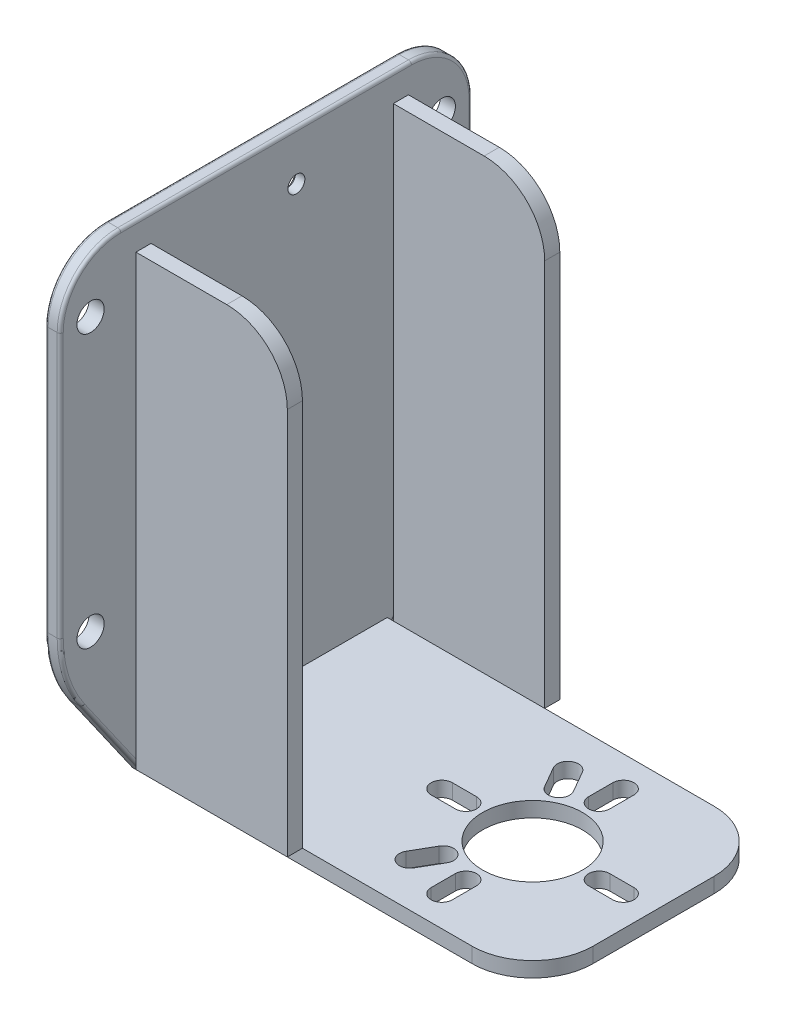
from build123d import *

# Parameters (mm, degrees)
SKETCH_1_W          = 64
SKETCH_1_H          = 40
SKETCH_1_R          = 8.25
EXTRUDE_1_DEPTH     = 2.5
EXTRUDE_2_DEPTH     = 2.5
SKETCH_6_W          = 2.5
SKETCH_6_H          = 68.008301529
EXTRUDE_3_DEPTH     = 60
SKETCH_7_R          = 2.25
CUT_EXTRUDE_1_DEPTH = 123.347999271
FILLET_1_R          = 10
FILLET_2_R          = 20
FILLET_4_R          = 10
FILLET_12_R         = 0.5
FILLET_13_R         = 0.5
SKETCH_8_W          = 25
SKETCH_8_H          = 2.5
EXTRUDE_5_DEPTH     = 74
EXTRUDE_5_2_DEPTH   = 74
FILLET_14_R         = 10
FILLET_15_R         = 10


with BuildPart() as part:
    # 草图1 → 凸台-拉伸1 (new body)
    with BuildSketch(Plane(origin=(0, 0, 0), x_dir=(1, 0, 0), z_dir=(0, 1, 0))):
        with Locations((-45.647943628, 32.876585816)):
            Rectangle(SKETCH_1_W, SKETCH_1_H)
        with Locations((-33.647943628, 32.876585816)):
            Circle(SKETCH_1_R, mode=Mode.SUBTRACT)
        with BuildLine():
            Line((-18.647943628, 31.126585816), (-22.647943628, 31.126585816))
            ThreePointArc((-22.647943628, 31.126585816), (-24.397943628, 32.876585816), (-22.647943628, 34.626585816))
            Line((-22.647943628, 34.626585816), (-18.647943628, 34.626585816))
            ThreePointArc((-18.647943628, 34.626585816), (-16.897943628, 32.876585816), (-18.647943628, 31.126585816))
        make_face(mode=Mode.SUBTRACT)
        with BuildLine():
            Line((-35.397943628, 17.876585816), (-35.397943628, 21.876585816))
            ThreePointArc((-35.397943628, 21.876585816), (-33.647943628, 23.626585816), (-31.897943628, 21.876585816))
            Line((-31.897943628, 21.876585816), (-31.897943628, 17.876585816))
            ThreePointArc((-31.897943628, 17.876585816), (-33.647943628, 16.126585816), (-35.397943628, 17.876585816))
        make_face(mode=Mode.SUBTRACT)
        with BuildLine():
            Line((-48.647943628, 34.626585816), (-44.647943628, 34.626585816))
            ThreePointArc((-44.647943628, 34.626585816), (-42.897943628, 32.876585816), (-44.647943628, 31.126585816))
            Line((-44.647943628, 31.126585816), (-48.647943628, 31.126585816))
            ThreePointArc((-48.647943628, 31.126585816), (-50.397943628, 32.876585816), (-48.647943628, 34.626585816))
        make_face(mode=Mode.SUBTRACT)
        with BuildLine():
            Line((-31.897943628, 47.876585816), (-31.897943628, 43.876585816))
            ThreePointArc((-31.897943628, 43.876585816), (-33.647943628, 42.126585816), (-35.397943628, 43.876585816))
            Line((-35.397943628, 43.876585816), (-35.397943628, 47.876585816))
            ThreePointArc((-35.397943628, 47.876585816), (-33.647943628, 49.626585816), (-31.897943628, 47.876585816))
        make_face(mode=Mode.SUBTRACT)
        with BuildLine():
            Line((-42.663488085, 21.01120476), (-40.663488085, 24.475306375))
            ThreePointArc((-40.663488085, 24.475306375), (-38.272943628, 25.115850831), (-37.632399171, 22.725306375))
            Line((-37.632399171, 22.725306375), (-39.632399171, 19.26120476))
            ThreePointArc((-39.632399171, 19.26120476), (-42.022943628, 18.620660303), (-42.663488085, 21.01120476))
        make_face(mode=Mode.SUBTRACT)
        with BuildLine():
            Line((-39.41589282, 46.866966873), (-37.41589282, 43.402865258))
            ThreePointArc((-37.41589282, 43.402865258), (-38.056437277, 41.012320801), (-40.446981734, 41.652865258))
            Line((-40.446981734, 41.652865258), (-42.446981734, 45.116966873))
            ThreePointArc((-42.446981734, 45.116966873), (-41.806437277, 47.50751133), (-39.41589282, 46.866966873))
        make_face(mode=Mode.SUBTRACT)
    extrude(amount=EXTRUDE_1_DEPTH)

    # 草图2 → 凸台-拉伸2 (add)
    with BuildSketch(Plane.ZY.offset(77.647943628)):
        Polygon((-66.880736581, 20), (-52.876585816, 0), (-12.876585816, 0), (1.127564948, 20), align=None)
    extrude(amount=EXTRUDE_2_DEPTH)

    # 草图6 → 凸台-拉伸3 (add)
    with BuildSketch(Plane(origin=(0, 20, 0), x_dir=(1, 0, 0), z_dir=(0, 1, 0))):
        with Locations((-78.897943628, 32.876585817)):
            Rectangle(SKETCH_6_W, SKETCH_6_H)
    extrude(amount=EXTRUDE_3_DEPTH)

    # 草图7 → 切除-拉伸1 (cut, through all)
    with BuildSketch(Plane(origin=(-77.647943628, 0, 0), x_dir=(0, 0, -1), z_dir=(1, 0, 0))):
        with Locations((61.880736581, 25)):
            Circle(SKETCH_7_R)
        with Locations((3.880736581, 25)):
            Circle(SKETCH_7_R)
        with Locations((61.880736581, 70)):
            Circle(SKETCH_7_R)
        with Locations((3.880736581, 70)):
            Circle(SKETCH_7_R)
    extrude(amount=-CUT_EXTRUDE_1_DEPTH, mode=Mode.SUBTRACT)

    # 圆角1
    fillet_1_edges = [part.edges().sort_by_distance(p)[0] for p in [
        (-13.647943628, 1.25, -12.876585816),
        (-13.647943628, 1.25, -52.876585816),
    ]]
    fillet(fillet_1_edges, radius=FILLET_1_R)

    # 圆角2
    fillet_2_edges = [part.edges().sort_by_distance(p)[0] for p in [
        (-78.897943628, 20, -66.880736581),
        (-78.897943628, 20, 1.127564948),
    ]]
    fillet(fillet_2_edges, radius=FILLET_2_R)

    # 圆角4
    fillet_4_edges = [part.edges().sort_by_distance(p)[0] for p in [
        (-78.897943628, 80, 1.127564948),
        (-78.897943628, 80, -66.880736581),
    ]]
    fillet(fillet_4_edges, radius=FILLET_4_R)

    # 圆角12
    fillet_12_edges = [part.edges().sort_by_distance(p)[0] for p in [
        (-77.647943628, 7.417223525, -58.070181641),
        (-77.647943628, 20.291859787, -65.955075596),
        (-77.647943628, 48.152987889, -66.880736581),
        (-77.647943628, 77.071067812, -63.951804393),
        (-77.647943628, 80, -32.876585816),
        (-77.647943628, 77.071067812, -1.80136724),
        (-77.647943628, 7.417223525, -7.682989991),
        (-77.647943628, 20.291859787, 0.201903963),
        (-77.647943628, 48.152987889, 1.127564948),
    ]]
    fillet(fillet_12_edges, radius=FILLET_12_R)

    # 圆角13
    fillet_13_edges = [part.edges().sort_by_distance(p)[0] for p in [
        (-80.147943628, 7.417223525, -58.070181641),
        (-80.147943628, 20.291859787, -65.955075596),
        (-80.147943628, 48.152987889, -66.880736581),
        (-80.147943628, 77.071067812, -63.951804393),
        (-80.147943628, 80, -32.876585816),
        (-80.147943628, 77.071067812, -1.80136724),
        (-80.147943628, 7.417223525, -7.682989991),
        (-80.147943628, 20.291859787, 0.201903963),
        (-80.147943628, 48.152987889, 1.127564948),
    ]]
    fillet(fillet_13_edges, radius=FILLET_13_R)

    # 草图13 → #3 平头机械螺钉的锥形沉头孔 (100)1 (revolve, cut)
    with BuildSketch(Plane(origin=(-80.147943628, 72, -37.876585816), x_dir=(0, 0, 1), z_dir=(0, 1, 0))):
        Polygon((0, 0), (0, 66.5), (1.397, 66.5), (1.397, 0.948434313), (2.5273, 0), align=None)
    revolve(axis=Axis((-86.497943628, 72, -37.876585816), (1, 0, 0)), mode=Mode.SUBTRACT)


with BuildPart() as body_2:
    # 草图8 → 凸台-拉伸5 (new body)
    with BuildSketch(Plane(origin=(0, 2.5, 0), x_dir=(1, 0, 0), z_dir=(0, 1, 0))):
        with Locations((-64.147943628, 54.126585816)):
            Rectangle(SKETCH_8_W, SKETCH_8_H)
    extrude(amount=EXTRUDE_5_DEPTH)

    # 圆角14
    fillet_14_edges = [body_2.edges().sort_by_distance(p)[0] for p in [
        (-51.647943628, 76.5, -54.126585816),
    ]]
    fillet(fillet_14_edges, radius=FILLET_14_R)


with BuildPart() as body_3:
    # 草图8 → Extrude 5 2 (new body)
    with BuildSketch(Plane(origin=(0, 2.5, 0), x_dir=(1, 0, 0), z_dir=(0, 1, 0))):
        with Locations((-64.147943628, 11.626585816)):
            Rectangle(SKETCH_8_W, SKETCH_8_H)
    extrude(amount=EXTRUDE_5_2_DEPTH)

    # 圆角15
    fillet_15_edges = [body_3.edges().sort_by_distance(p)[0] for p in [
        (-51.647943628, 76.5, -11.626585816),
    ]]
    fillet(fillet_15_edges, radius=FILLET_15_R)


solid = Compound([part.part, body_2.part, body_3.part])
